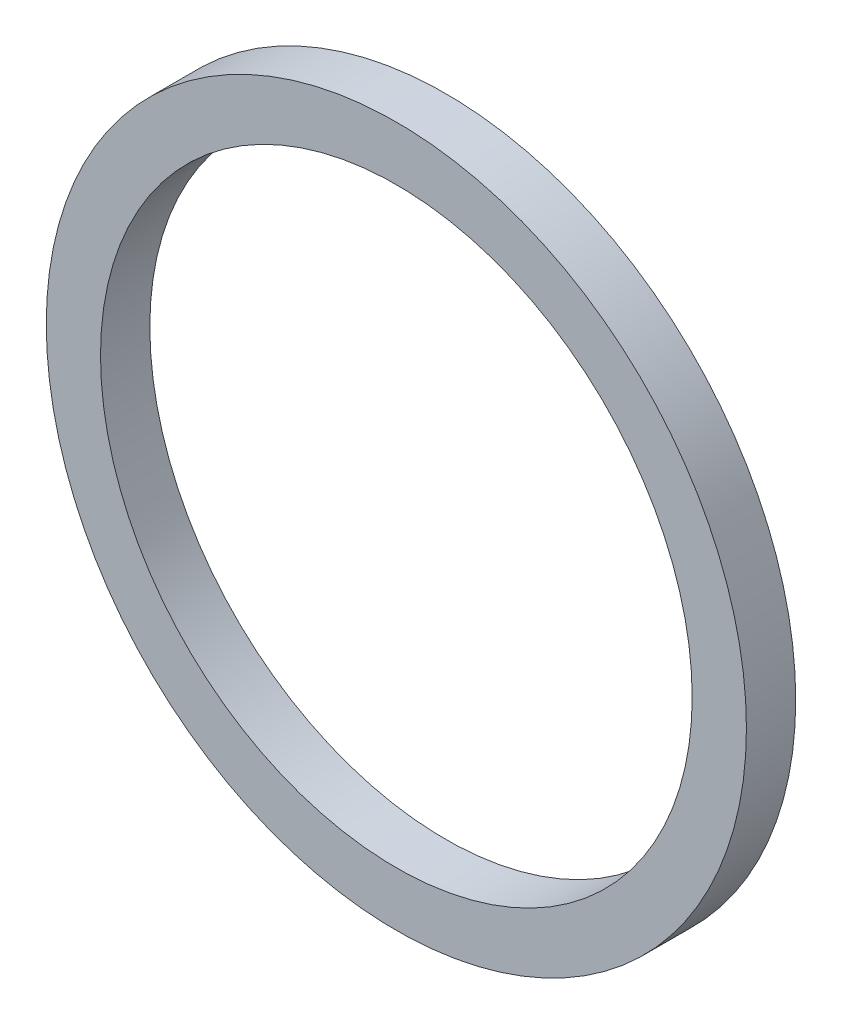
from build123d import *

# Parameters (mm, degrees)
SKETCH1_R           = 22.5425
SKETCH1_R_2         = 19.05
BOSS_EXTRUDE1_DEPTH = 3.175


with BuildPart() as part:
    # Sketch1 → Boss-Extrude1 (new body)
    with BuildSketch(Plane.XY):
        Circle(SKETCH1_R)
        Circle(SKETCH1_R_2, mode=Mode.SUBTRACT)
    extrude(amount=BOSS_EXTRUDE1_DEPTH)


solid = part.part
